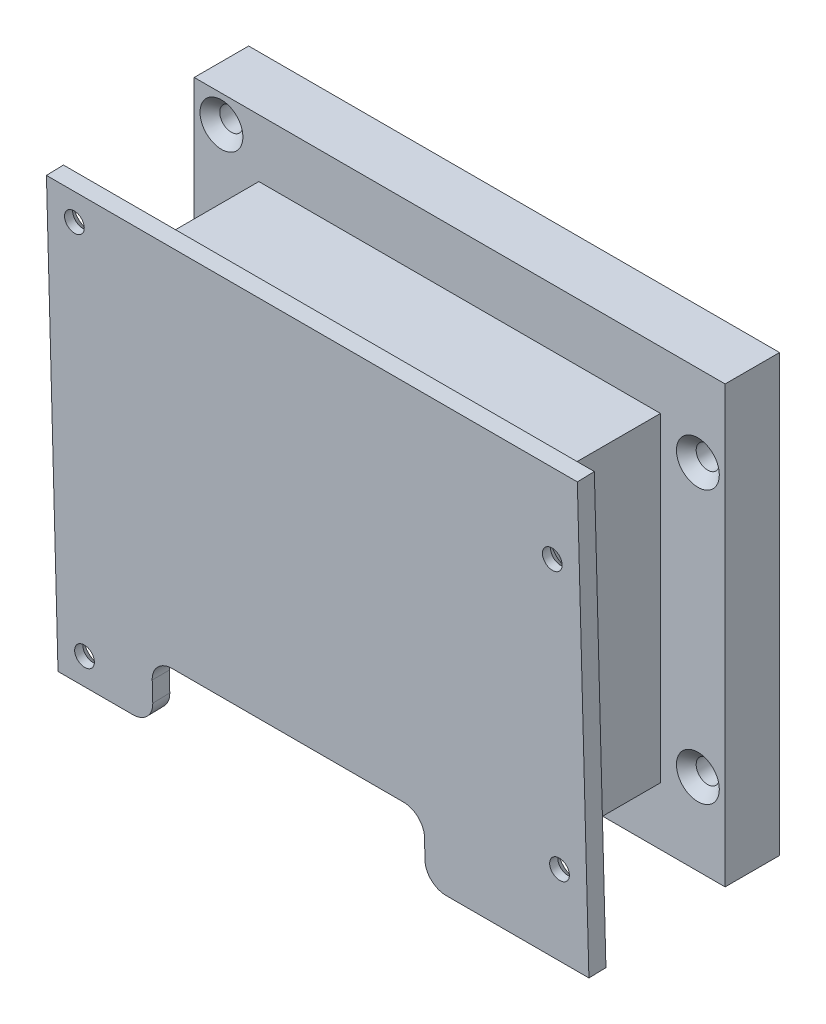
from build123d import *

# Parameters (mm, degrees)
ESQUISSE1_W                                      = 78
ESQUISSE1_H                                      = 64
ESQUISSE1_R                                      = 1.5
BOSS_EXTRU_1_DEPTH                               = 8
FRAISAGE_POUR_VIS_T_TE_FRAIS_E_M31_D             = 3.4
FRAISAGE_POUR_VIS_T_TE_FRAIS_E_M31_DEPTH         = 8
FRAISAGE_POUR_VIS_T_TE_FRAIS_E_M31_CSINK_D       = 6.3
FRAISAGE_POUR_VIS_T_TE_FRAIS_E_M31_CSINK_ANGLE   = 90
ESQUISSE4_W                                      = 59
ESQUISSE4_H                                      = 47
BOSS_EXTRU_2_DEPTH                               = 20
ENL_V_START                                      = -27.764118658
ENL_V_MAT_EXTRU_1_OUTLINE_W                      = 62
ENL_V_MAT_EXTRU_1_OUTLINE_H                      = 50
ENL_V_MAT_EXTRU_1_DEPTH                          = 1.24955815
ESQUISSE14_W                                     = 78
ESQUISSE14_H                                     = 64
ESQUISSE14_R                                     = 1
BOSS_EXTRU_4_DEPTH                               = 2.5
FRAISAGE_POUR_VIS_T_TE_FRAIS_E_M2_53_D           = 2.9
FRAISAGE_POUR_VIS_T_TE_FRAIS_E_M2_53_DEPTH       = 2.5
FRAISAGE_POUR_VIS_T_TE_FRAIS_E_M2_53_CSINK_D     = 5.5
FRAISAGE_POUR_VIS_T_TE_FRAIS_E_M2_53_CSINK_ANGLE = 90
FRAISAGE_POUR_VIS_T_TE_FRAIS_E_M2_53_TIP         = 0.871247898
ENL_V_MAT_EXTRU_2_REACH                          = 108.208
ESQUISSE20_W                                     = 40
ESQUISSE20_H                                     = 10
CONG_1_R                                         = 3


# Read off the part's stored shape, not the designer's step: Enlèv. mat.-Extru.1
with BuildPart() as part:
    # Esquisse1 → Boss.-Extru.1 (new body)
    with BuildSketch(Plane.XY):
        with Locations((39, 32)):
            Rectangle(ESQUISSE1_W, ESQUISSE1_H)
        with Locations((4, 60)):
            Circle(ESQUISSE1_R, mode=Mode.SUBTRACT)
        with Locations((4, 4)):
            Circle(ESQUISSE1_R, mode=Mode.SUBTRACT)
        with Locations((74, 12)):
            Circle(ESQUISSE1_R, mode=Mode.SUBTRACT)
        with Locations((74, 52)):
            Circle(ESQUISSE1_R, mode=Mode.SUBTRACT)
    extrude(amount=BOSS_EXTRU_1_DEPTH)

    # Fraisage pour vis à tête fraisée M31
    with Locations(Plane.XY.offset(8)):
        with Locations((4, 60), (4, 4), (74, 12), (74, 52)):
            CounterSinkHole(FRAISAGE_POUR_VIS_T_TE_FRAIS_E_M31_D / 2, FRAISAGE_POUR_VIS_T_TE_FRAIS_E_M31_CSINK_D / 2, depth=FRAISAGE_POUR_VIS_T_TE_FRAIS_E_M31_DEPTH, counter_sink_angle=FRAISAGE_POUR_VIS_T_TE_FRAIS_E_M31_CSINK_ANGLE)

    # Esquisse4 → Boss.-Extru.2 (add)
    with BuildSketch(Plane.XY.offset(8)):
        with Locations((39, 32)):
            Rectangle(ESQUISSE4_W, ESQUISSE4_H)
    extrude(amount=BOSS_EXTRU_2_DEPTH)

    # Enlèv. mat.-Extru.1 outline → Enlèv. mat.-Extru.1 (cut)
    with BuildSketch(Plane(origin=(0, 0, 0), x_dir=(1, 0, 0), z_dir=(0, 0.026586343635431896, -0.9996465206922389)).offset(ENL_V_START)):
        with Locations((39, -33)):
            Rectangle(ENL_V_MAT_EXTRU_1_OUTLINE_W, ENL_V_MAT_EXTRU_1_OUTLINE_H)
    extrude(amount=ENL_V_MAT_EXTRU_1_DEPTH, mode=Mode.SUBTRACT)

    # Esquisse14 → Boss.-Extru.4 (add)
    with BuildSketch(Plane(origin=(0, 17.262764885, 26.983052258), x_dir=(1, 0, 0), z_dir=(0, 0.026586343635431917, -0.9996465206922389))):
        with Locations((40, -14.216024519)):
            Rectangle(ESQUISSE14_W, ESQUISSE14_H)
        with Locations(Location((5, 13.783975481, 0), (0, 0, 270))):
            Circle(ESQUISSE14_R, mode=Mode.SUBTRACT)
        with Locations(Location((5, -42.216024519, 0), (0, 0, 270))):
            Circle(ESQUISSE14_R, mode=Mode.SUBTRACT)
        with Locations(Location((75, -34.216024519, 0), (0, 0, 270))):
            Circle(ESQUISSE14_R, mode=Mode.SUBTRACT)
        with Locations(Location((75, 5.783975481, 0), (0, 0, 270))):
            Circle(ESQUISSE14_R, mode=Mode.SUBTRACT)
    extrude(amount=-BOSS_EXTRU_4_DEPTH)

    # Fraisage pour vis à tête fraisée M2.53
    with Locations(Plane(origin=(0, -0.704925217, 26.505188159), x_dir=(-1, 0, 0), z_dir=(0, 0.02658634363543186, -0.9996465206922389))):
        with Locations((-5, 60.190068073), (-5, 4.190068073), (-75, 12.190068073), (-75, 52.190068073)):
            CounterSinkHole(FRAISAGE_POUR_VIS_T_TE_FRAIS_E_M2_53_D / 2, FRAISAGE_POUR_VIS_T_TE_FRAIS_E_M2_53_CSINK_D / 2, depth=FRAISAGE_POUR_VIS_T_TE_FRAIS_E_M2_53_DEPTH, counter_sink_angle=FRAISAGE_POUR_VIS_T_TE_FRAIS_E_M2_53_CSINK_ANGLE)
            with Locations((0, 0, -(FRAISAGE_POUR_VIS_T_TE_FRAIS_E_M2_53_DEPTH + FRAISAGE_POUR_VIS_T_TE_FRAIS_E_M2_53_TIP / 2))):  # 118° drill point
                Cone(0, FRAISAGE_POUR_VIS_T_TE_FRAIS_E_M2_53_D / 2, FRAISAGE_POUR_VIS_T_TE_FRAIS_E_M2_53_TIP, mode=Mode.SUBTRACT)

    # Enlèv. mat.-Extru.2: up to this plane
    enl_v_mat_extru_2_end = Plane(origin=(0, -0.771391076, 29.004304461), z_dir=(0, -0.026586343635431952, 0.9996465206922389))
    # Esquisse20 → Enlèv. mat.-Extru.2 (cut, up to the surface)
    with BuildSketch(Plane(origin=(0, 0, 0), x_dir=(-1, 0, 0), z_dir=(0, 0, -1)), mode=Mode.PRIVATE) as enl_v_mat_extru_2_sk1:
        with Locations((-35, 3.418609812)):
            Rectangle(ESQUISSE20_W, ESQUISSE20_H)
    enl_v_mat_extru_2_tool1 = split(extrude(enl_v_mat_extru_2_sk1.sketch, amount=-ENL_V_MAT_EXTRU_2_REACH, mode=Mode.PRIVATE), bisect_by=enl_v_mat_extru_2_end, keep=Keep.BOTH, mode=Mode.PRIVATE)
    add(enl_v_mat_extru_2_tool1.solids().sort_by_distance((35, 3.41861, 0))[0], mode=Mode.SUBTRACT)

    # Congé1
    cong_1_edges = [part.edges().sort_by_distance(p)[0] for p in [
        (15, -0.548157258, 27.759799525),
        (55, -0.548157258, 27.759799525),
        (55, 8.418609812, 4),
        (55, 8.418609812, 27.998277373),
        (55, 0, 4),
        (15, 0, 4),
        (15, 8.418609812, 4),
        (15, 8.418609812, 27.998277373),
    ]]
    fillet(cong_1_edges, radius=CONG_1_R)


solid = part.part
